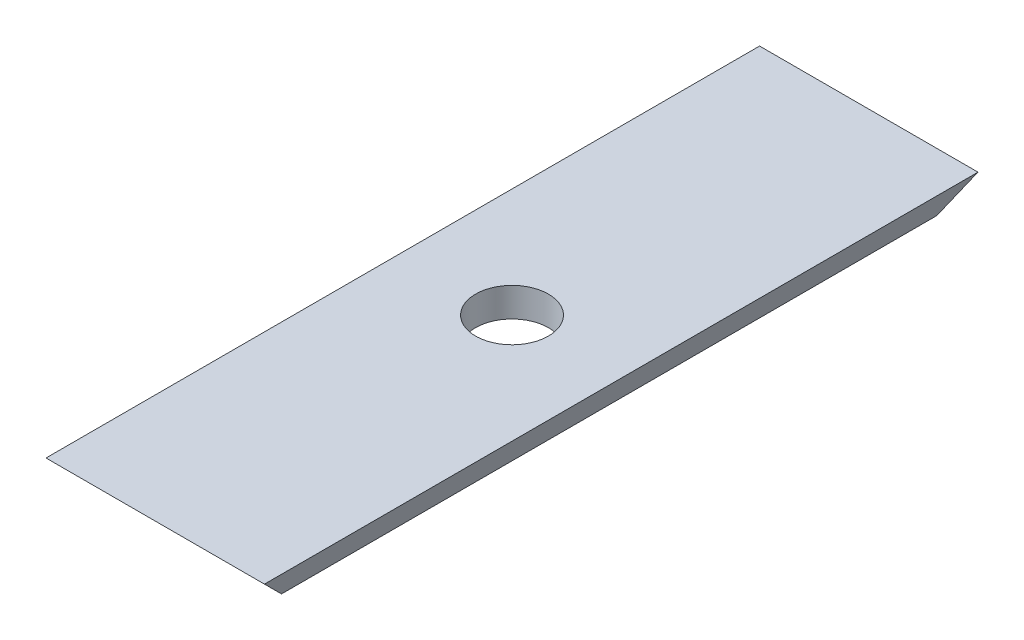
from build123d import *

# Parameters (mm, degrees)
ESBO_O1_W                = 150
ESBO_O1_H                = 20
RESSALTO_EXTRUS_O1_DEPTH = 490
CHANFRO1_SIZE            = 20
ESBO_O2_R                = 25
CORTE_EXTRUS_O1_DEPTH    = 513.835256198
CHANFRO2_SIZE2           = 20
CHANFRO2_SIZE            = 8.284271247


# Some blends are built 0.0001 mm under size
with BuildPart() as part:
    # Esboço1 → Ressalto-extrusão1 (new body)
    with BuildSketch(Plane.XY):
        with Locations((75, 10)):
            Rectangle(ESBO_O1_W, ESBO_O1_H)
    extrude(amount=RESSALTO_EXTRUS_O1_DEPTH)

    # Chanfro1
    # the kernel refuses this chamfer: 20 mm, written as the material it takes off along each edge
    with BuildSketch(Plane(origin=(-51.433659759, 0, 490), x_dir=(0, -0.027495876610586334, -0.9996219169112968), z_dir=(1, 0, 0))) as chanfro1_piece_1:
        Polygon((CHANFRO1_SIZE * 0.999621916911, CHANFRO1_SIZE * 0.0274958766106), (-CHANFRO1_SIZE * 0.0274958766106, CHANFRO1_SIZE * 0.999621916911), (0, 0), align=None)
    extrude(amount=252.867319519, mode=Mode.SUBTRACT)
    with BuildSketch(Plane(origin=(0, 0, -51.433659759), x_dir=(0.9996219169112968, -0.027495876610586372, 0), z_dir=(0, 0, 1))) as chanfro1_piece_2:
        Polygon((CHANFRO1_SIZE * 0.999621916911, CHANFRO1_SIZE * 0.0274958766106), (-CHANFRO1_SIZE * 0.0274958766106, CHANFRO1_SIZE * 0.999621916911), (0, 0), align=None)
    extrude(amount=592.867319519, mode=Mode.SUBTRACT)
    with BuildSketch(Plane(origin=(-51.433659759, 0, 0), x_dir=(0, -0.027495876610586372, 0.9996219169112968), z_dir=(1, 0, 0))) as chanfro1_piece_3:
        Polygon((CHANFRO1_SIZE * 0.999621916911, -CHANFRO1_SIZE * 0.0274958766106), (-CHANFRO1_SIZE * 0.0274958766106, -CHANFRO1_SIZE * 0.999621916911), (0, 0), align=None)
    extrude(amount=252.867319519, mode=Mode.SUBTRACT)

    # Esboço2 → Corte-extrusão1 (cut, through all)
    with BuildSketch(Plane(origin=(0, 0, 0), x_dir=(-1, 0, 0), z_dir=(0, -1, 0))):
        with Locations(Location((-75, -245, 0), (0, 0, 90))):
            Circle(ESBO_O2_R)
    extrude(amount=-CORTE_EXTRUS_O1_DEPTH, mode=Mode.SUBTRACT)

    # Chanfro2
    chanfro2_edges = [part.edges().sort_by_distance(p)[0] for p in [
        (150, 0, 245),
    ]]
    chanfro2_side = [part.faces().sort_by_distance(p)[0] for p in [
        (149.834314575, 0, 245),
    ]]
    chamfer(chanfro2_edges, length=CHANFRO2_SIZE - 0.0001, length2=CHANFRO2_SIZE2 - 0.0001, reference=chanfro2_side[0])  # a hair under: the kernel refuses the full size


solid = part.part
